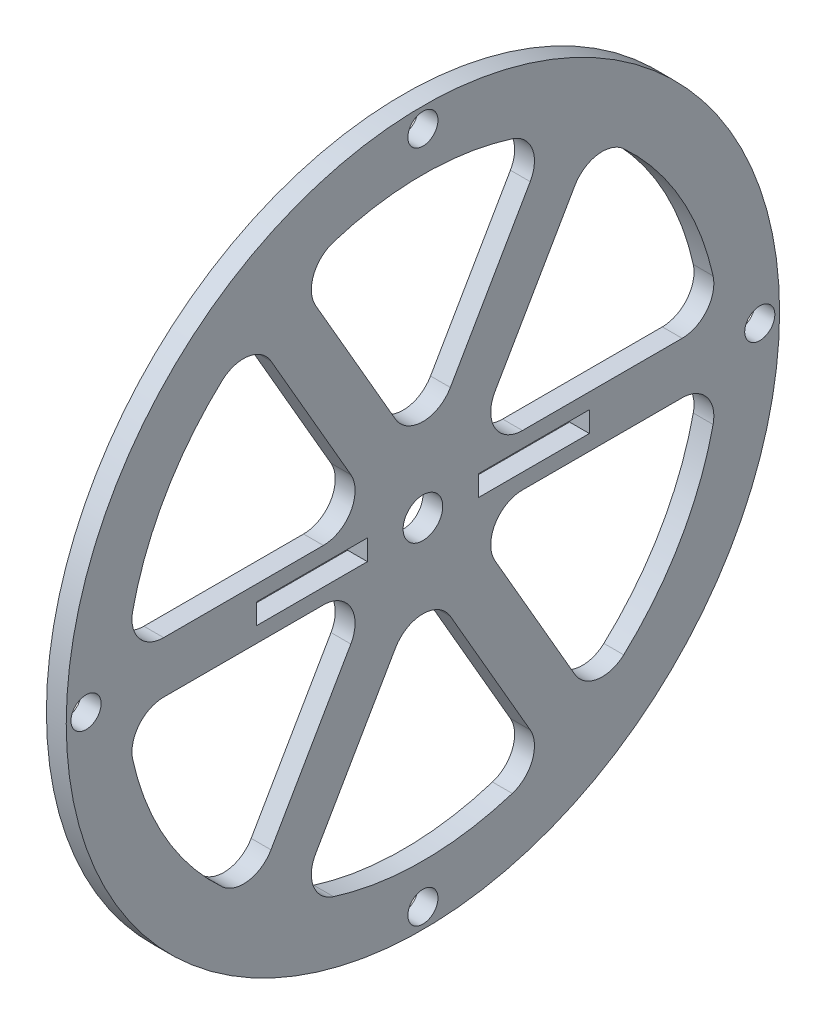
from build123d import *

# Parameters (mm, degrees)
SKETCH1_R              = 57.15
SKETCH1_W              = 17.78
SKETCH1_H              = 3.302
BOSS_EXTRUDE1_DEPTH    = 3.175
CUT_EXTRUDE1_START     = -3.175
CUT_EXTRUDE1_OUTLINE_R = 3.175
CUT_EXTRUDE1_DEPTH     = 3.175
F_10_24_TAPPED_HOLE1_D = 4.826


# Read off the part's stored shape, not the designer's step: Cut-Extrude1
with BuildPart() as part:
    # Sketch1 → Boss-Extrude1 (new body)
    with BuildSketch(Plane(origin=(0, 0, 0), x_dir=(0, 0, -1), z_dir=(1, 0, 0))):
        Circle(SKETCH1_R)
        with Locations((-17.78, 0)):
            Rectangle(SKETCH1_W, SKETCH1_H, mode=Mode.SUBTRACT)
        with Locations((17.78, 0)):
            Rectangle(SKETCH1_W, SKETCH1_H, mode=Mode.SUBTRACT)
    extrude(amount=BOSS_EXTRUDE1_DEPTH)

    # Cut-Extrude1 outline → Cut-Extrude1 (cut)
    with BuildSketch(Plane(origin=(3.175, 0, 0), x_dir=(0, 0, -1), z_dir=(1, 0, 0)).offset(CUT_EXTRUDE1_START)):
        with BuildLine():
            Line((-17.193839306, 38.035603254), (-4.399409051, 15.875))
            ThreePointArc((-4.399409051, 15.875), (0, 13.335), (4.399409051, 15.875))
            Line((4.399409051, 15.875), (17.193839306, 38.035603254))
            ThreePointArc((17.193839306, 38.035603254), (17.529050695, 42.416735863), (14.322123419, 45.420451404))
            ThreePointArc((14.322123419, 45.420451404), (0, 47.625), (-14.322123419, 45.420451404))
            ThreePointArc((-14.322123419, 45.420451404), (-17.529050695, 42.416735863), (-17.193839306, 38.035603254))
        make_face()
        with BuildLine():
            ThreePointArc((15.947857811, -4.1275), (11.548448759, -6.6675), (11.548448759, -11.7475))
            Line((11.548448759, -11.7475), (24.342879014, -33.908103254))
            ThreePointArc((24.342879014, -33.908103254), (27.969445455, -36.388971138), (32.174203058, -35.113548419))
            ThreePointArc((32.174203058, -35.113548419), (41.244459855, -23.8125), (46.496326477, -10.306902985))
            ThreePointArc((46.496326477, -10.306902985), (45.49849615, -6.027764725), (41.536718319, -4.1275))
            Line((41.536718319, -4.1275), (15.947857811, -4.1275))
        make_face()
        with BuildLine():
            ThreePointArc((-24.342879014, 33.908103254), (-27.969445455, 36.388971138), (-32.174203058, 35.113548419))
            ThreePointArc((-32.174203058, 35.113548419), (-41.244459855, 23.8125), (-46.496326477, 10.306902985))
            ThreePointArc((-46.496326477, 10.306902985), (-45.49849615, 6.027764725), (-41.536718319, 4.1275))
            Line((-41.536718319, 4.1275), (-15.947857811, 4.1275))
            ThreePointArc((-15.947857811, 4.1275), (-11.548448759, 6.6675), (-11.548448759, 11.7475))
            Line((-11.548448759, 11.7475), (-24.342879014, 33.908103254))
        make_face()
        with BuildLine():
            ThreePointArc((-41.536718319, -4.1275), (-45.49849615, -6.027764725), (-46.496326477, -10.306902985))
            ThreePointArc((-46.496326477, -10.306902985), (-41.244459855, -23.8125), (-32.174203058, -35.113548419))
            ThreePointArc((-32.174203058, -35.113548419), (-27.969445455, -36.388971138), (-24.342879014, -33.908103254))
            Line((-24.342879014, -33.908103254), (-11.548448759, -11.7475))
            ThreePointArc((-11.548448759, -11.7475), (-11.548448759, -6.6675), (-15.947857811, -4.1275))
            Line((-15.947857811, -4.1275), (-41.536718319, -4.1275))
        make_face()
        with BuildLine():
            ThreePointArc((-17.193839306, -38.035603254), (-17.529050695, -42.416735863), (-14.322123419, -45.420451404))
            ThreePointArc((-14.322123419, -45.420451404), (0, -47.625), (14.322123419, -45.420451404))
            ThreePointArc((14.322123419, -45.420451404), (17.529050695, -42.416735863), (17.193839306, -38.035603254))
            Line((17.193839306, -38.035603254), (4.399409051, -15.875))
            ThreePointArc((4.399409051, -15.875), (0, -13.335), (-4.399409051, -15.875))
            Line((-4.399409051, -15.875), (-17.193839306, -38.035603254))
        make_face()
        with BuildLine():
            ThreePointArc((41.536718319, 4.1275), (45.49849615, 6.027764725), (46.496326477, 10.306902985))
            ThreePointArc((46.496326477, 10.306902985), (41.244459855, 23.8125), (32.174203058, 35.113548419))
            ThreePointArc((32.174203058, 35.113548419), (27.969445455, 36.388971138), (24.342879014, 33.908103254))
            Line((24.342879014, 33.908103254), (11.548448759, 11.7475))
            ThreePointArc((11.548448759, 11.7475), (11.548448759, 6.6675), (15.947857811, 4.1275))
            Line((15.947857811, 4.1275), (41.536718319, 4.1275))
        make_face()
        Circle(CUT_EXTRUDE1_OUTLINE_R)
    extrude(amount=CUT_EXTRUDE1_DEPTH, mode=Mode.SUBTRACT)

    # #10-24 Tapped Hole1 (through all)
    with Locations(Plane(origin=(3.175, 0, 0), x_dir=(0, 0, -1), z_dir=(1, 0, 0))):
        with Locations((-53.975, 0), (0, 53.975), (53.975, 0), (0, -53.975)):
            Hole(F_10_24_TAPPED_HOLE1_D / 2)


solid = part.part
